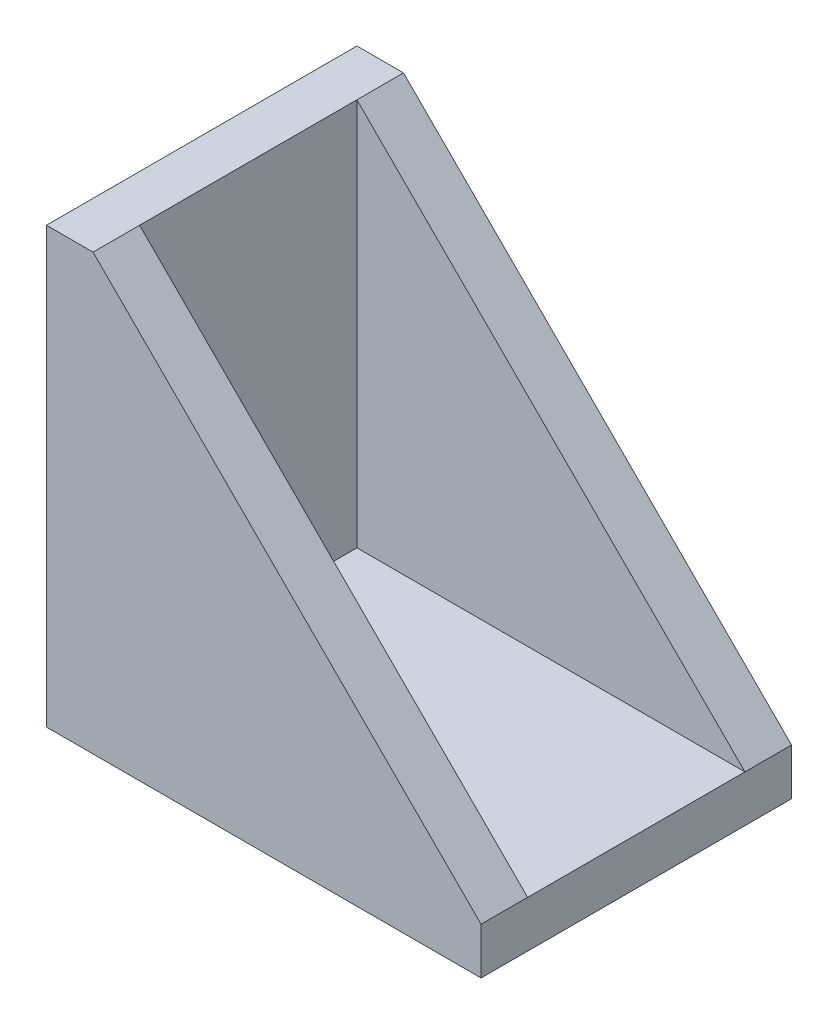
from build123d import *

# Parameters (mm, degrees)
BODY_DEPTH      = 10
SHELL_START     = 3
SHELL_OUTLINE_W = 26
SHELL_OUTLINE_H = 14
SHELL_DEPTH     = 25


# Read off the part's stored shape, not the designer's step: Shell
with BuildPart() as part:
    # Sketch1 → Body (new, symmetric)
    with BuildSketch(Plane.XY):
        Polygon((28, 0), (0, 0), (0, 28), (3, 28), (28, 3), align=None)
    extrude(amount=BODY_DEPTH, both=True)

    # Shell outline → Shell (cut)
    with BuildSketch(Plane.YZ.offset(SHELL_START)):
        with Locations((16, 0)):
            Rectangle(SHELL_OUTLINE_W, SHELL_OUTLINE_H)
    extrude(amount=SHELL_DEPTH, mode=Mode.SUBTRACT)


solid = part.part
